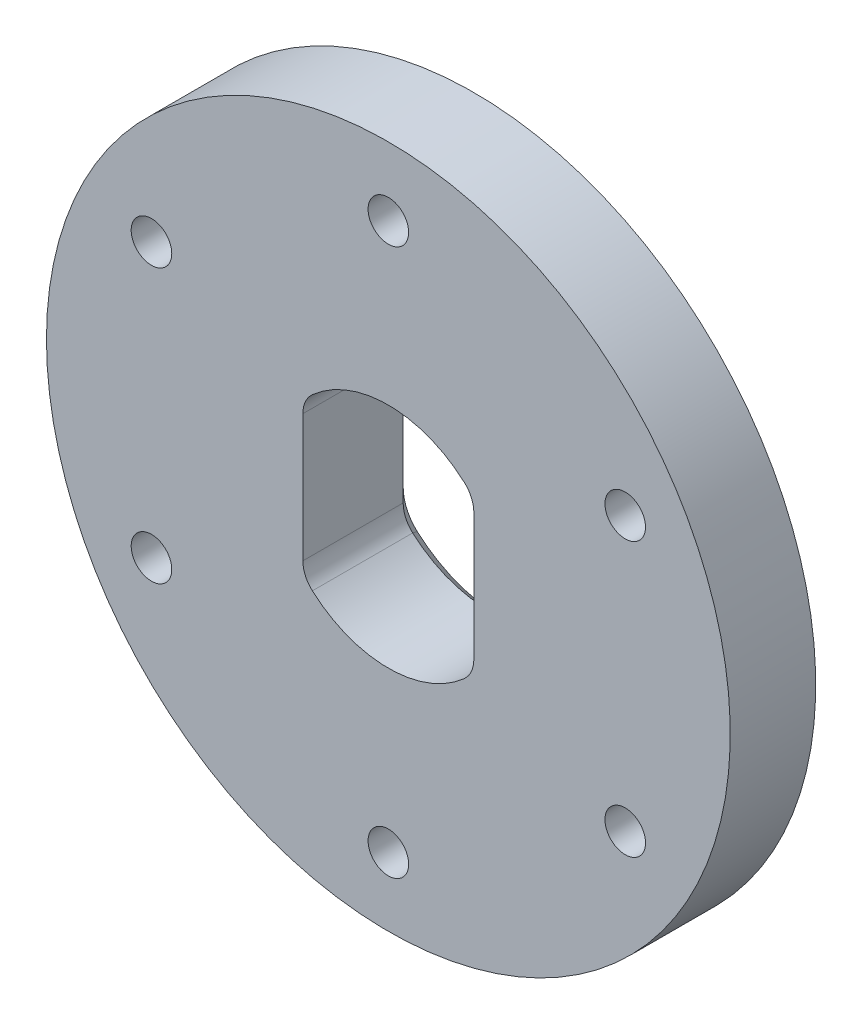
from build123d import *

# Parameters (mm, degrees)
SKETCH1_R             = 19.05
BOSS_EXTRUDE1_DEPTH   = 4.7625
SKETCH2_R             = 11.1125
BOSS_EXTRUDE2_DEPTH   = 1.5875
FILLET1_R             = 1.5875
CUT_EXTRUDE1_DEPTH    = 28.679008291
FILLET2_R             = 1.5875
F_4_40_TAPPED_HOLE1_D = 2.2606
CIRPATTERN1_COUNT     = 6
CHAMFER1_SIZE         = 0.762


with BuildPart() as part:
    # Sketch1 → Boss-Extrude1 (new body)
    with BuildSketch(Plane.XY):
        with Locations(Location((0, 0, 0), (0, 0, 180))):
            Circle(SKETCH1_R)
    extrude(amount=BOSS_EXTRUDE1_DEPTH)

    # Sketch2 → Boss-Extrude2 (add)
    with BuildSketch(Plane(origin=(0, 0, 0), x_dir=(-1, 0, 0), z_dir=(0, 0, -1))):
        with Locations(Location((0, 0, 0), (0, 0, 180))):
            Circle(SKETCH2_R)
    extrude(amount=BOSS_EXTRUDE2_DEPTH)

    # Fillet1
    fillet1_edges = [part.edges().sort_by_distance(p)[0] for p in [
        (-11.1125, 0, 0),
    ]]
    fillet(fillet1_edges, radius=FILLET1_R - 0.0001)  # a hair under: the kernel refuses the full size

    # Sketch3 → Cut-Extrude1 (cut, through all)
    with BuildSketch(Plane(origin=(0, 0, -1.5875), x_dir=(-1, 0, 0), z_dir=(0, 0, -1))):
        with BuildLine():
            Line((-4.7625, 4.200130206), (-4.7625, -4.200130206))
            ThreePointArc((-4.7625, -4.200130206), (0, -6.35), (4.7625, -4.200130206))
            Line((4.7625, -4.200130206), (4.7625, 4.200130206))
            ThreePointArc((4.7625, 4.200130206), (0, 6.35), (-4.7625, 4.200130206))
        make_face()
    extrude(amount=-CUT_EXTRUDE1_DEPTH, mode=Mode.SUBTRACT)

    # Fillet2
    fillet2_edges = [part.edges().sort_by_distance(p)[0] for p in [
        (4.7625, 4.200130206, 1.5875),
        (-4.7625, 4.200130206, 1.5875),
        (-4.7625, -4.200130206, 1.5875),
        (4.7625, -4.200130206, 1.5875),
    ]]
    fillet(fillet2_edges, radius=FILLET2_R)

    # #4-40 Tapped Hole1 (through all)
    with Locations(Plane.XY.offset(4.7625)):
        with Locations((0, 15.24)):
            f_4_40_tapped_hole1 = Hole(F_4_40_TAPPED_HOLE1_D / 2)

    # CirPattern1: #4-40 Tapped Hole1 ×6 about axis
    cirpattern1_axis = Axis((0, 0, 0), (0, 0, 1))
    for i in range(1, CIRPATTERN1_COUNT):
        add(f_4_40_tapped_hole1.rotate(cirpattern1_axis, i * 360 / CIRPATTERN1_COUNT), mode=Mode.SUBTRACT)

    # Chamfer1
    chamfer1_edges = [part.edges().sort_by_distance(p)[0] for p in [
        (-4.7625, 0, -1.5875),
        (0, -6.35, -1.5875),
        (4.7625, 0, -1.5875),
        (0, 6.35, -1.5875),
        (-4.6241826, -4.197852075, -1.5875),
        (4.6241826, -4.197852075, -1.5875),
        (-4.6241826, 4.197852075, -1.5875),
        (4.6241826, 4.197852075, -1.5875),
    ]]
    chamfer(chamfer1_edges, length=CHAMFER1_SIZE)


solid = part.part
